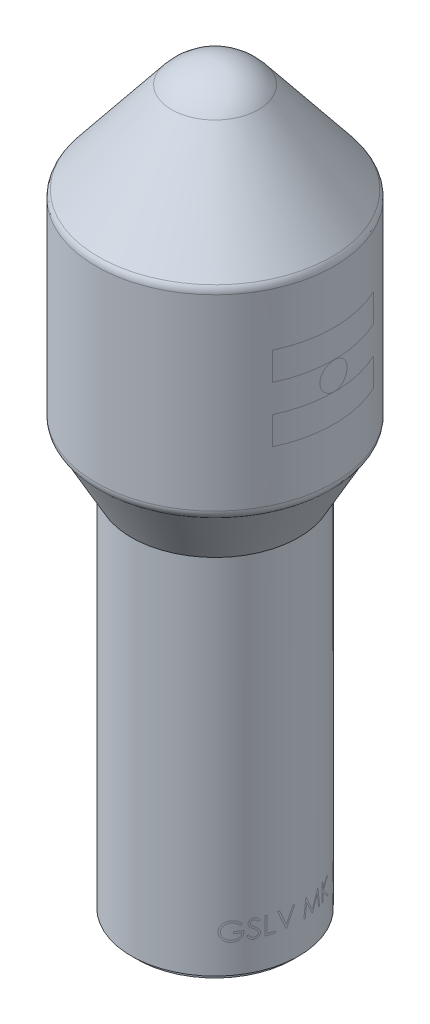
from build123d import *


with BuildPart() as part:
    # Sketch1 → Revolve1 (revolve)
    with BuildSketch(Plane.XY):
        with BuildLine():
            Line((0, 32.227256137), (0, 168.787256137))
            ThreePointArc((0, 168.787256137), (4.326901821, 167.80268295), (7.80177334, 165.042840263))
            Line((7.80177334, 165.042840263), (20.89, 148.719603972))
            ThreePointArc((20.89, 148.719603972), (21.216535543, 148.13154471), (21.329645332, 147.468487146))
            Line((21.329645332, 147.468487146), (21.329645332, 113.887916625))
            ThreePointArc((21.329645332, 113.887916625), (21.138154089, 113.033928291), (20.600349258, 112.343471244))
            Line((20.600349258, 112.343471244), (15, 102.210967089))
            Line((15, 102.210967089), (15, 37.210967089))
            Line((15, 37.210967089), (14, 37.210967089))
            Line((14, 37.210967089), (14, 36.210967089))
            add(Edge.make_bspline(
                [(14, 36.210967089), (11.22432869, 34.82347138), (0.978166546, 32.170279683), (0, 32.227256137)],
                knots=[0, 0, 0, 0, 1, 1, 1, 1], degree=3))
        make_face()
    revolve(axis=Axis((0, 32.227256137, 0), (0, 1, 0)))


solid = part.part
